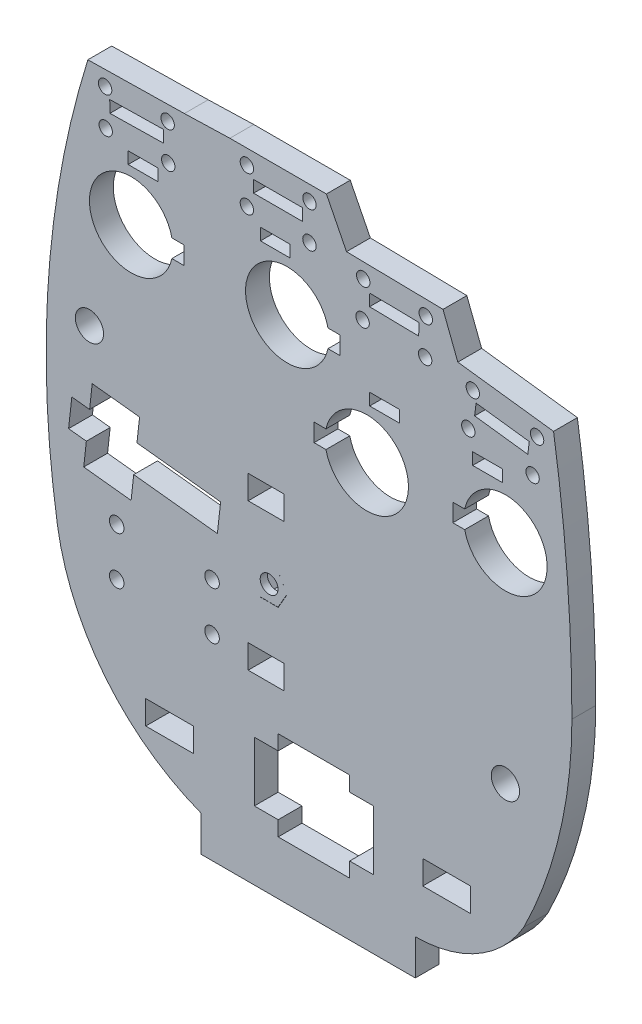
from build123d import *

# Parameters (mm, degrees)
SKETCH1_R           = 2.375
SKETCH1_R_2         = 1.225
SKETCH1_R_3         = 1.125
SKETCH1_W           = 8.25
SKETCH1_H           = 2
SKETCH1_W_2         = 5
SKETCH1_W_3         = 6.000000352
SKETCH1_H_2         = 4
BOSS_EXTRUDE1_DEPTH = 4
SKETCH3_W           = 8
SKETCH3_H           = 4
CUT_EXTRUDE2_DEPTH  = 97.20299248
SKETCH4_R           = 2.1
CUT_EXTRUDE3_DEPTH  = 2
SKETCH5_R           = 1.5
BOSS_EXTRUDE2_DEPTH = 1.2


with BuildPart() as part:
    # Sketch1 → Boss-Extrude1 (new body)
    with BuildSketch(Plane.XY):
        with BuildLine():
            Line((-12.978641063, -17.999999648), (-12.978641063, -24))
            Line((-12.978641063, -24), (23.021361236, -24))
            Line((23.021361236, -24), (23.021361236, -17.999999648))
            ThreePointArc((23.021361236, -17.999999648), (33.533081461, -15.187018076), (41.234956591, -7.5))
            ThreePointArc((41.234956591, -7.5), (47.261249953, 9.161168651), (49.306345049, 26.760269155))
            ThreePointArc((49.306345049, 26.760269155), (48.53517536, 46.971383776), (46.226150624, 67.064971353))
            Line((46.226150624, 67.064971353), (30.153849376, 69.095028647))
            Line((30.153849376, 69.095028647), (27.668766331, 75.523635508))
            Line((27.668766331, 75.523635508), (11.471233669, 75.806364492))
            Line((11.471233669, 75.806364492), (8.1, 82.51))
            Line((8.1, 82.51), (-8.1, 82.51))
            Line((-8.1, 82.51), (-15.746235706, 82.281481113))
            Line((-15.746235706, 82.281481113), (-31.943764294, 81.998518887))
            ThreePointArc((-31.943764294, 81.998518887), (-38.536008, 47.204020641), (-37.052658257, 11.821617405))
            ThreePointArc((-37.052658257, 11.821617405), (-29.003702847, -6.308616172), (-12.978641063, -17.999999648))
        make_face()
        with Locations((38.147341743, 11.821617405)):
            Circle(SKETCH1_R, mode=Mode.SUBTRACT)
        with Locations((-27.1, 8.875641236)):
            Circle(SKETCH1_R_2, mode=Mode.SUBTRACT)
        with Locations((-27.1, 16.875641236)):
            Circle(SKETCH1_R_2, mode=Mode.SUBTRACT)
        with Locations((-11.1, 8.875641236)):
            Circle(SKETCH1_R_2, mode=Mode.SUBTRACT)
        with Locations((-11.1, 16.875641236)):
            Circle(SKETCH1_R_2, mode=Mode.SUBTRACT)
        with Locations((-5.25, 80.01)):
            Circle(SKETCH1_R_3, mode=Mode.SUBTRACT)
        with Locations((32.668103408, 66.257595536)):
            Circle(SKETCH1_R_3, mode=Mode.SUBTRACT)
        with Locations((-31.681501662, 43.456405989)):
            Circle(SKETCH1_R, mode=Mode.SUBTRACT)
        with Locations((5.25, 80.01)):
            Circle(SKETCH1_R_3, mode=Mode.SUBTRACT)
        with Locations((5.25, 74.01)):
            Circle(SKETCH1_R_3, mode=Mode.SUBTRACT)
        with Locations((-5.25, 74.01)):
            Circle(SKETCH1_R_3, mode=Mode.SUBTRACT)
        with Locations((-29.050567347, 79.548639007)):
            Circle(SKETCH1_R_3, mode=Mode.SUBTRACT)
        with Locations((-18.552097199, 79.732041708)):
            Circle(SKETCH1_R_3, mode=Mode.SUBTRACT)
        with Locations((-28.945766522, 73.549554345)):
            Circle(SKETCH1_R_3, mode=Mode.SUBTRACT)
        with Locations((-18.447296374, 73.732957046)):
            Circle(SKETCH1_R_3, mode=Mode.SUBTRACT)
        with Locations((24.670854945, 67.074669457)):
            Circle(SKETCH1_R_3, mode=Mode.SUBTRACT)
        with Locations((14.172454146, 67.257919725)):
            Circle(SKETCH1_R_3, mode=Mode.SUBTRACT)
        with Locations((24.775569383, 73.073755628)):
            Circle(SKETCH1_R_3, mode=Mode.SUBTRACT)
        with Locations((14.277168584, 73.257005896)):
            Circle(SKETCH1_R_3, mode=Mode.SUBTRACT)
        with Locations((31.916230336, 60.30489137)):
            Circle(SKETCH1_R_3, mode=Mode.SUBTRACT)
        with Locations((43.457736871, 64.89478048)):
            Circle(SKETCH1_R_3, mode=Mode.SUBTRACT)
        with Locations((42.705863799, 58.942076315)):
            Circle(SKETCH1_R_3, mode=Mode.SUBTRACT)
        with Locations((0, 77.51)):
            Rectangle(SKETCH1_W, SKETCH1_H, mode=Mode.SUBTRACT)
        Polygon((-10.203, 23.9877015), (-9.6615, 28.865490815), (-23.703732608, 30.424366869), (-23.262390208, 34.399944423), (-31.213545315, 35.282629224), (-31.654887716, 31.30705167), (-34.636570881, 31.63805847), (-35.178070881, 26.760269155), (-32.196387716, 26.429262355), (-32.637730116, 22.453684801), (-24.686575009, 21.571), (-24.245232608, 25.546577554), align=None, mode=Mode.SUBTRACT)
        with BuildLine():
            Line((10.358817838, 63.151218734), (10.358817838, 60.151218734))
            Line((10.358817838, 60.151218734), (8.358817838, 60.151218734))
            ThreePointArc((8.358817838, 60.151218734), (-5.478579327, 61.651218734), (8.358817838, 63.151218734))
            Line((8.358817838, 63.151218734), (10.358817838, 63.151218734))
        make_face(mode=Mode.SUBTRACT)
        with Locations((35.147341743, 56.321617405)):
            Rectangle(SKETCH1_W_2, SKETCH1_H, mode=Mode.SUBTRACT)
        with BuildLine():
            Line((-17.84156291, 63.151218734), (-15.84156291, 63.151218734))
            Line((-15.84156291, 63.151218734), (-15.84156291, 60.151218734))
            Line((-15.84156291, 60.151218734), (-17.84156291, 60.151218734))
            ThreePointArc((-17.84156291, 60.151218734), (-31.678960076, 61.651218734), (-17.84156291, 63.151218734))
        make_face(mode=Mode.SUBTRACT)
        Polygon((-28.274482275, 78.062008978), (-19.275783292, 78.219211472), (-19.240849684, 76.219516585), (-28.239548667, 76.06231409), align=None, mode=Mode.SUBTRACT)
        with Locations((17.86306514, 56.321617405)):
            Rectangle(SKETCH1_W_2, SKETCH1_H, mode=Mode.SUBTRACT)
        with Locations((-0.478579327, 71.151218734)):
            Rectangle(SKETCH1_W_2, SKETCH1_H, mode=Mode.SUBTRACT)
        Polygon((15.375818632, 71.737600396), (15.340913819, 69.737905006), (23.589657304, 69.593922653), (23.624562117, 71.593618043), align=None, mode=Mode.SUBTRACT)
        with BuildLine():
            Line((8.025667975, 48.321617405), (6.025667975, 48.321617405))
            Line((6.025667975, 48.321617405), (6.025667975, 45.321617405))
            Line((6.025667975, 45.321617405), (8.025667975, 45.321617405))
            ThreePointArc((8.025667975, 45.321617405), (21.86306514, 46.821617405), (8.025667975, 48.321617405))
        make_face(mode=Mode.SUBTRACT)
        Polygon((42.153636572, 63.54758064), (33.223865999, 64.675480473), (32.973241642, 62.691245751), (41.903012214, 61.563345918), align=None, mode=Mode.SUBTRACT)
        with BuildLine():
            Line((29.309944577, 45.321617405), (31.309944577, 45.321617405))
            ThreePointArc((31.309944577, 45.321617405), (45.147341743, 46.821617405), (31.309944577, 48.321617405))
            Line((31.309944577, 48.321617405), (29.309944577, 48.321617405))
            Line((29.309944577, 48.321617405), (29.309944577, 45.321617405))
        make_face(mode=Mode.SUBTRACT)
        with Locations((-22.678960076, 71.151218734)):
            Rectangle(SKETCH1_W_2, SKETCH1_H, mode=Mode.SUBTRACT)
        Polygon((-4, -2.5), (0, -2.5), (0, 0), (12, 0), (12, -2.5), (16, -2.5), (16, -12.5), (12, -12.5), (12, -15), (0, -15), (0, -12.5), (-4, -12.5), align=None, mode=Mode.SUBTRACT)
        Polygon((0, 23.56093555), (-3, 23.56093555), (-4.5, 20.962859339), (-3, 18.364783128), (0, 18.364783128), (1.5, 20.962859339), align=None, mode=Mode.SUBTRACT)
        with Locations((-2.036620161, 8.717005814)):
            Rectangle(SKETCH1_W_3, SKETCH1_H_2, mode=Mode.SUBTRACT)
        with Locations((-2.036620161, 33.335566927)):
            Rectangle(SKETCH1_W_3, SKETCH1_H_2, mode=Mode.SUBTRACT)
    extrude(amount=BOSS_EXTRUDE1_DEPTH)

    # Sketch3 → Cut-Extrude2 (cut, through all)
    with BuildSketch(Plane(origin=(0, 0, 0), x_dir=(-1, 0, 0), z_dir=(0, 0, -1))):
        with Locations((-28.271360086, -8)):
            Rectangle(SKETCH3_W, SKETCH3_H)
        with Locations((18.228639914, -8)):
            Rectangle(SKETCH3_W, SKETCH3_H)
    extrude(amount=-CUT_EXTRUDE2_DEPTH, mode=Mode.SUBTRACT)

    # Sketch4 → Cut-Extrude3 (cut)
    with BuildSketch(Plane(origin=(0, 0, 0), x_dir=(-1, 0, 0), z_dir=(0, 0, -1))):
        with Locations((27.1, 16.875641236)):
            Circle(SKETCH4_R)
        with Locations((27.1, 8.875641236)):
            Circle(SKETCH4_R)
        with Locations((11.1, 8.875641236)):
            Circle(SKETCH4_R)
        with Locations((11.1, 16.875641236)):
            Circle(SKETCH4_R)
    extrude(amount=-CUT_EXTRUDE3_DEPTH, mode=Mode.SUBTRACT)

    # Sketch5 → Boss-Extrude2 (add)
    with BuildSketch(Plane.XY.offset(4)):
        Polygon((-3.018844903, 18.391695962), (-0.018844903, 18.391695962), (1.481155097, 20.989772174), (-0.018844903, 23.587848385), (-3.018844903, 23.587848385), (-4.518844903, 20.989772174), align=None)
        with Locations((-1.518844903, 20.989772174)):
            Circle(SKETCH5_R, mode=Mode.SUBTRACT)
    extrude(amount=-BOSS_EXTRUDE2_DEPTH)


solid = part.part
